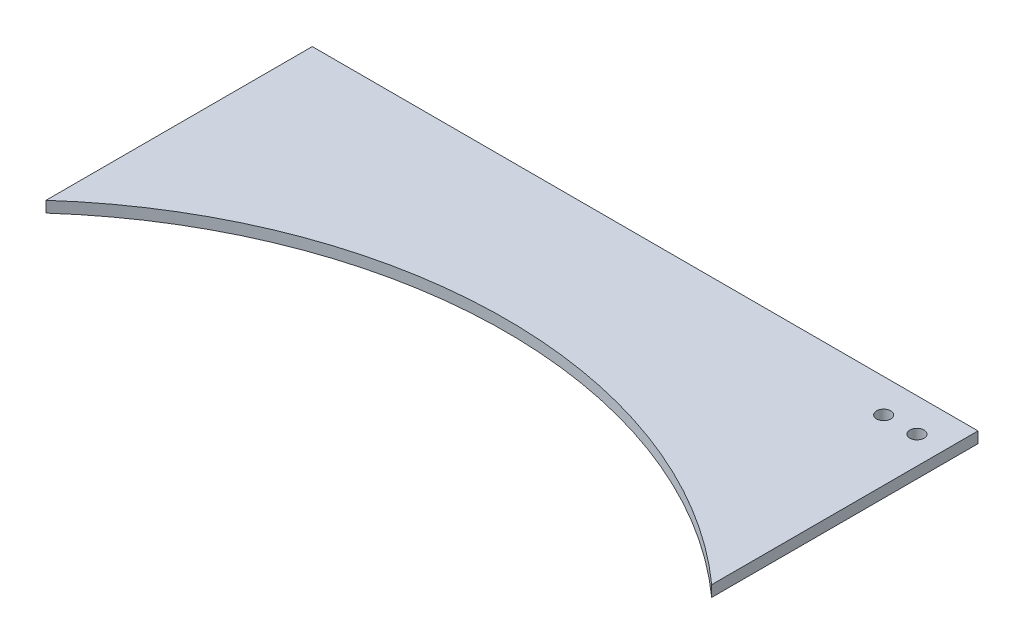
from build123d import *

# Parameters (mm, degrees)
BOSS_EXTRUDE1_DEPTH = 3.175
SKETCH3_R           = 2.032
CUT_EXTRUDE1_DEPTH  = 206.199343627


with BuildPart() as part:
    # Sketch1 → Boss-Extrude1 (new body)
    with BuildSketch(Plane(origin=(0, 0, 0), x_dir=(1, 0, 0), z_dir=(0, 1, 0))):
        with BuildLine():
            Line((0, 0), (0, 76.2))
            Line((0, 76.2), (190.5, 76.2))
            Line((190.5, 76.2), (190.5, 0))
            ThreePointArc((190.5, 0), (95.25, 36.382262572), (0, 0))
        make_face()
    extrude(amount=BOSS_EXTRUDE1_DEPTH)

    # Sketch3 → Cut-Extrude1 (cut, through all)
    with BuildSketch(Plane.XZ):
        with Locations((182.5625, -66.675)):
            Circle(SKETCH3_R)
        with Locations((173.0375, -66.675)):
            Circle(SKETCH3_R)
    extrude(amount=-CUT_EXTRUDE1_DEPTH, mode=Mode.SUBTRACT)


solid = part.part
